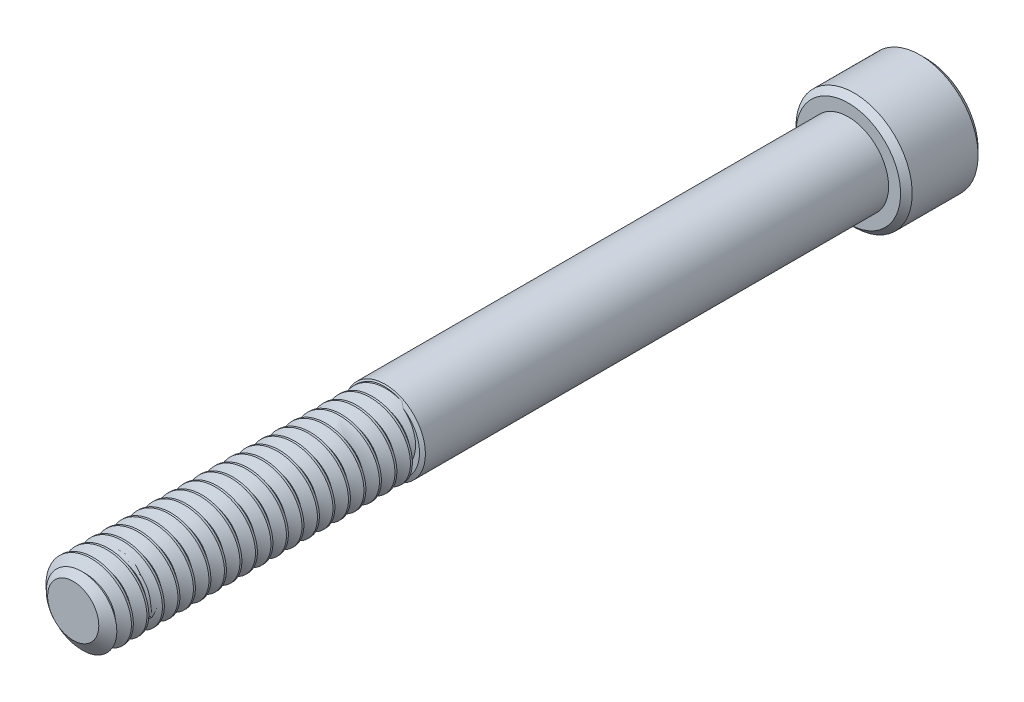
from build123d import *

# Parameters (mm, degrees)
SKETCH1_R          = 3.175
EXTRUDE1_DEPTH     = 63.5
CUT_SWEEP1_PITCH   = 1.27
SKETCH6_R          = 4.7625
EXTRUDE2_DEPTH     = 6.35
CUT_EXTRUDE1_DEPTH = 3.571875
CHAMFER1_SIZE      = 0.47625


with BuildPart() as part:
    # Sketch1 → Extrude1 (new body)
    with BuildSketch(Plane.XY):
        Circle(SKETCH1_R)
    extrude(amount=-EXTRUDE1_DEPTH)

    # Cut-Sweep1: the profile of Sketch3 profile screwed along a right-hand helix of 51 turns, 6 arcs to a turn; built about Z, then put on its axis
    cut_sweep1_z = Axis((0, 0, 0), (0, 0, 1))
    cut_sweep1_corners = [(3.1753, 0, -1.111423205), (2.350110803, 0, -0.635), (2.350110803, 0, -0.47625), (3.1753, 0, 0.000173205)]
    with BuildLine(mode=Mode.PRIVATE) as cut_sweep1_profile:
        Line(cut_sweep1_corners[0], cut_sweep1_corners[1])
        Line(cut_sweep1_corners[1], cut_sweep1_corners[2])
        Line(cut_sweep1_corners[2], cut_sweep1_corners[3])
        Line(cut_sweep1_corners[3], cut_sweep1_corners[0])
    cut_sweep1_cap = Face(cut_sweep1_profile.wire())
    cut_sweep1_turn_angles = [0, 30, 60, 90, 120, 150, 180, 210, 240, 270, 300, 330, 360, 390, 420, 450, 480, 510, 540, 570, 600, 630, 660, 690, 720]
    cut_sweep1_turn_weights = [1, 0.8660254037844387, 1, 0.8660254037844387, 1, 0.8660254037844387, 1, 0.8660254037844387, 1, 0.8660254037844387, 1, 0.8660254037844387, 1, 0.8660254037844387, 1, 0.8660254037844387, 1, 0.8660254037844387, 1, 0.8660254037844387, 1, 0.8660254037844387, 1, 0.8660254037844387, 1]
    cut_sweep1_turn_rails = [Edge.make_bspline([Vector(p[0], p[1], 0).rotate(cut_sweep1_z, cut_sweep1_turn_angles[k]) / cut_sweep1_turn_weights[k] + Vector(0, 0, p[2] + CUT_SWEEP1_PITCH * cut_sweep1_turn_angles[k] / 360) for k in range(25)], [0, 0, 0, 1, 1, 2, 2, 3, 3, 4, 4, 5, 5, 6, 6, 7, 7, 8, 8, 9, 9, 10, 10, 11, 11, 12, 12, 12], 2, cut_sweep1_turn_weights) for p in cut_sweep1_corners]
    cut_sweep1_turn_sides = [Face.make_surface_from_curves(cut_sweep1_turn_rails[p[0]], cut_sweep1_turn_rails[p[1]]) for p in [(0, 1), (1, 2), (2, 3), (3, 0)]]
    cut_sweep1_last_angles = [18000, 18030, 18060, 18090, 18120, 18150, 18180, 18210, 18240, 18270, 18300, 18330, 18360]
    cut_sweep1_last_weights = [1, 0.8660254037844387, 1, 0.8660254037844387, 1, 0.8660254037844387, 1, 0.8660254037844387, 1, 0.8660254037844387, 1, 0.8660254037865023, 1]
    cut_sweep1_last_rails = [Edge.make_bspline([Vector(p[0], p[1], 0).rotate(cut_sweep1_z, cut_sweep1_last_angles[k]) / cut_sweep1_last_weights[k] + Vector(0, 0, p[2] + CUT_SWEEP1_PITCH * cut_sweep1_last_angles[k] / 360) for k in range(13)], [0, 0, 0, 1, 1, 2, 2, 3, 3, 4, 4, 5, 5, 6, 6, 6], 2, cut_sweep1_last_weights) for p in cut_sweep1_corners]
    cut_sweep1_last_sides = [Face.make_surface_from_curves(cut_sweep1_last_rails[p[0]], cut_sweep1_last_rails[p[1]]) for p in [(0, 1), (1, 2), (2, 3), (3, 0)]]
    cut_sweep1 = Plane(origin=(0, 0, 0), x_dir=(0, 1, 0), z_dir=(0, 0, -1)) * Solid(Shell([*[p.moved(Location((0, 0, 2 * CUT_SWEEP1_PITCH * i))) for i in range(25) for p in cut_sweep1_turn_sides], *cut_sweep1_last_sides, cut_sweep1_cap, cut_sweep1_cap.rotate(cut_sweep1_z, 18360).moved(Location((0, 0, CUT_SWEEP1_PITCH * 18360 / 360)))]))
    add(cut_sweep1, mode=Mode.SUBTRACT)

    # Sketch4 → Cut-Revolve1 (revolve, cut)
    with BuildSketch(Plane(origin=(0, 0, 0), x_dir=(0, 0, -1), z_dir=(1, 0, 0)), mode=Mode.PRIVATE) as cut_revolve1_sk:
        Polygon((0.755446349, 3.175), (0, 2.096110803), (0, 3.175), align=None)
    revolve(cut_revolve1_sk.sketch.rotate(Axis((0, 0, 0), (0, 0, -1)), 270), axis=Axis((0, 0, 0), (0, 0, -1)), mode=Mode.SUBTRACT)

    # Sketch5 → partially thread (revolve)
    with BuildSketch(Plane(origin=(0, 0, 0), x_dir=(0, 0, -1), z_dir=(1, 0, 0)), mode=Mode.PRIVATE) as partially_thread_sk:
        Polygon((63.5, 3.302), (25.553974789, 3.302), (25.4, 2.9718), (25.4, 0), (63.5, 0), align=None)
    revolve(partially_thread_sk.sketch.rotate(Axis((0, 0, 0), (0, 0, -1)), 270), axis=Axis((0, 0, 0), (0, 0, -1)))

    # Sketch6 → Extrude2 (add)
    with BuildSketch(Plane(origin=(0, 0, -63.5), x_dir=(-1, 0, 0), z_dir=(0, 0, -1))):
        Circle(SKETCH6_R)
    extrude(amount=EXTRUDE2_DEPTH)

    # Sketch7 → Cut-Extrude1 (cut)
    with BuildSketch(Plane(origin=(0, 0, -69.85), x_dir=(-1, 0, 0), z_dir=(0, 0, -1))):
        Polygon((0, 2.749630657), (-2.38125, 1.374815329), (-2.38125, -1.374815329), (0, -2.749630657), (2.38125, -1.374815329), (2.38125, 1.374815329), align=None)
    extrude(amount=-CUT_EXTRUDE1_DEPTH, mode=Mode.SUBTRACT)

    # Cut-Extrude2 cone 1 section (through the dimple's axis) → Cut-Extrude2 (revolve, cut)
    with BuildSketch(Plane(origin=(0, 0, -69.85), x_dir=(0, 1, 0), z_dir=(1, 0, 0))):
        Polygon((0, 0), (2.749630657, 0), (0, 2.749630657), align=None)
    revolve(axis=Axis((0, 0, -69.85), (0, 0, 1)), mode=Mode.SUBTRACT)

    # Chamfer1
    chamfer1_edges = [part.edges().sort_by_distance(p)[0] for p in [
        (4.7625, 0, -63.5),
        (4.7625, 0, -69.85),
    ]]
    chamfer(chamfer1_edges, length=CHAMFER1_SIZE)


solid = part.part
